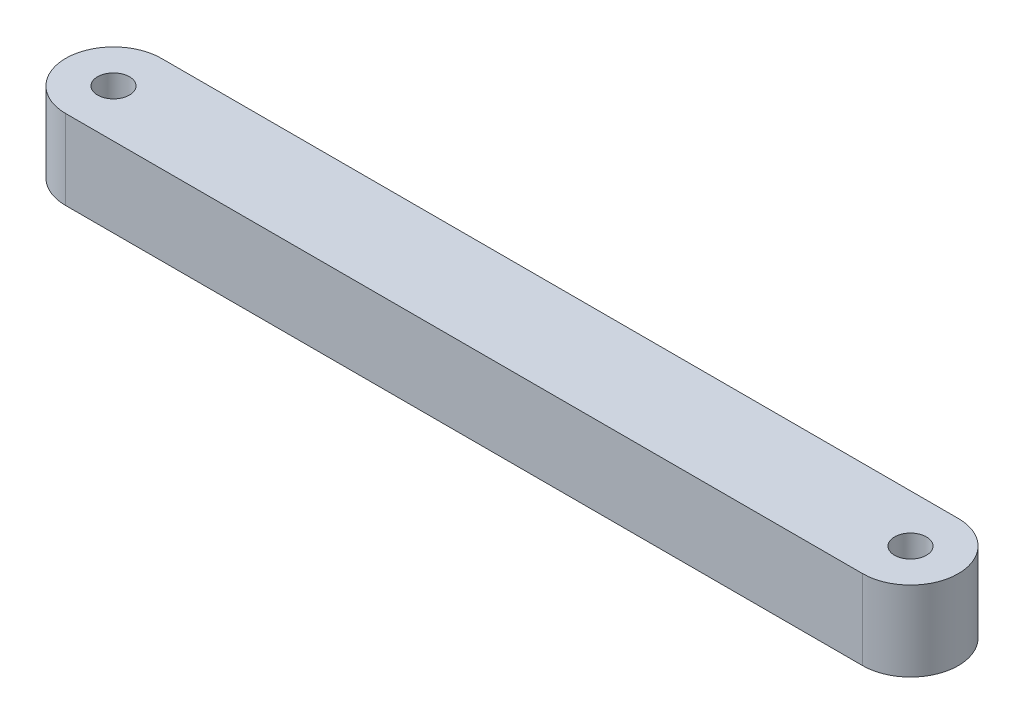
from build123d import *

# Parameters (mm, degrees)
BOSS_EXTRUDE1_DEPTH = 12.7
SKETCH4_R           = 2.54
CUT_EXTRUDE3_DEPTH  = 73.645776202


with BuildPart() as part:
    # Sketch3 → Boss-Extrude1 (new body)
    with BuildSketch(Plane(origin=(0, 0, 0), x_dir=(1, 0, 0), z_dir=(0, 1, 0))):
        with BuildLine():
            Line((-63.5, 7.62), (63.5, 7.62))
            ThreePointArc((63.5, 7.62), (71.12, 0), (63.5, -7.62))
            Line((63.5, -7.62), (-63.5, -7.62))
            ThreePointArc((-63.5, -7.62), (-71.12, 0), (-63.5, 7.62))
        make_face()
    extrude(amount=BOSS_EXTRUDE1_DEPTH)

    # Sketch4 → Cut-Extrude3 (cut, through all)
    with BuildSketch(Plane(origin=(0, 12.7, 0), x_dir=(1, 0, 0), z_dir=(0, 1, 0))):
        with Locations((-63.5, 0)):
            Circle(SKETCH4_R)
        with Locations((63.5, 0)):
            Circle(SKETCH4_R)
    extrude(amount=-CUT_EXTRUDE3_DEPTH, mode=Mode.SUBTRACT)


solid = part.part
